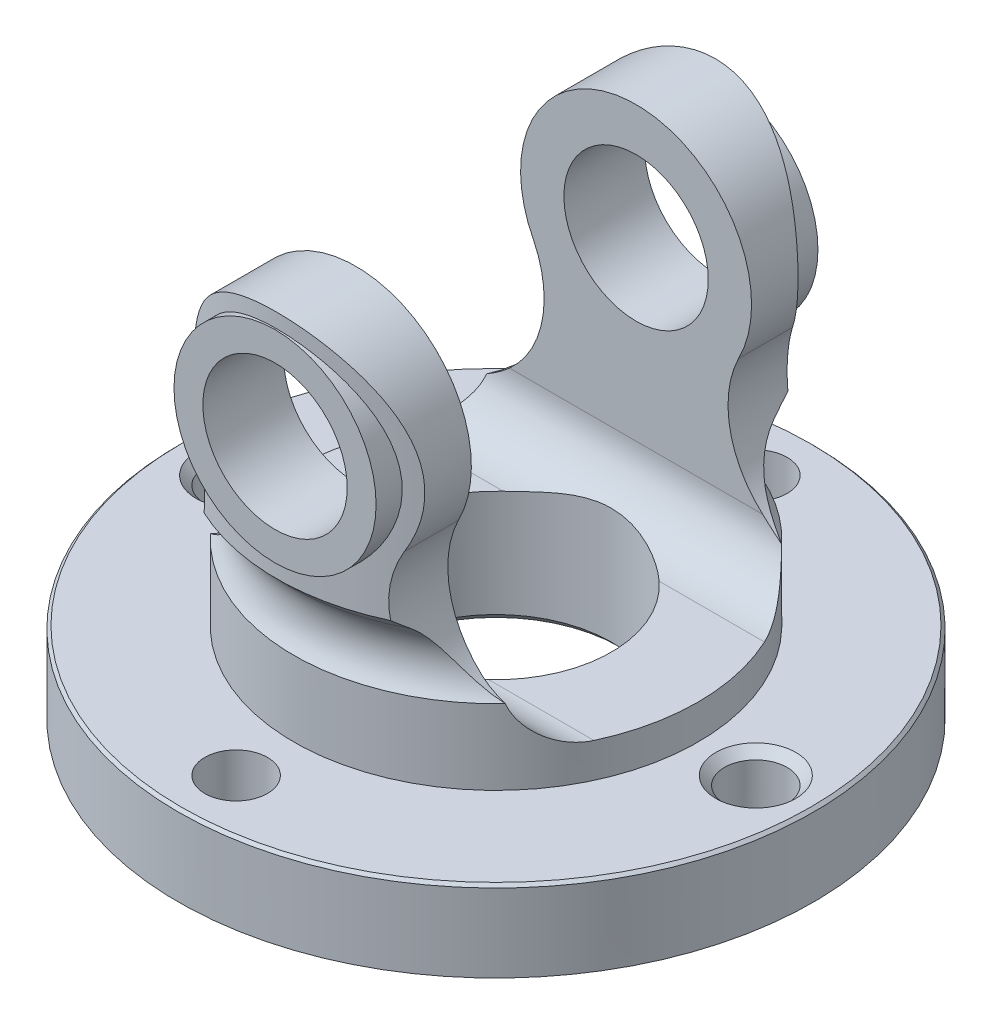
from build123d import *

# Parameters (mm, degrees)
CUT_EXTRUDE3_DEPTH      = 112.579568022
CUT_EXTRUDE3_DEPTH_BACK = 112.579568022
SKETCH2_W               = 15
SKETCH2_H               = 48
CUT_EXTRUDE4_DEPTH      = 112.579568022
CUT_EXTRUDE4_DEPTH_BACK = 112.579568022
SKETCH3_W               = 48.522720568
SKETCH3_H               = 48
FILLET1_R               = 8
DELETEFACE1_START       = 26.9999999
DELETEFACE1_DEPTH       = 53.0000001
SKETCH4_R               = 17.5
SKETCH4_R_2             = 12.5
BOSS_EXTRUDE1_DEPTH     = 14
CUT_EXTRUDE5_DEPTH      = 112.579568094
CUT_EXTRUDE5_DEPTH_BACK = 112.579568094
SKETCH5_R               = 12.5
CUT_EXTRUDE6_DEPTH      = 103.009803515
CUT_EXTRUDE6_DEPTH_BACK = 103.009803515
SKETCH8_R               = 5.425
CHAMFER1_SIZE           = 1.5
CHAMFER2_SIZE           = 0.5
CUT_EXTRUDE7_DEPTH      = 112.579568094
CUT_EXTRUDE7_DEPTH_BACK = 112.579568094
CUT_EXTRUDE8_DEPTH      = 112.579568094
CUT_EXTRUDE8_DEPTH_BACK = 112.579568094


with BuildPart() as part:
    # Sketch1 → Revolve1 (revolve)
    with BuildSketch(Plane.XY, mode=Mode.PRIVATE) as revolve1_sk:
        Polygon((20, 0), (55, 0), (55, 14), (35, 14), (35, 27), (30, 32), (38, 40), (38, 80), (30, 80), (30, 40), (20, 30), (20, 14), align=None)
    revolve(revolve1_sk.sketch.rotate(Axis((0, 0, 0), (0, 1, 0)), 90), axis=Axis((0, 0, 0), (0, 1, 0)))

    # Sketch2 → Cut-Extrude3 (cut, two sides: drawn at the far end of the back side and taken through both)
    with BuildSketch(Plane.XY.offset(-CUT_EXTRUDE3_DEPTH_BACK)):
        with Locations((-30.5, 56)):
            Rectangle(SKETCH2_W, SKETCH2_H)
        with Locations((30.5, 56)):
            Rectangle(SKETCH2_W, SKETCH2_H)
    extrude(amount=CUT_EXTRUDE3_DEPTH + CUT_EXTRUDE3_DEPTH_BACK, mode=Mode.SUBTRACT)

    # Sketch3 → Cut-Extrude4 (cut, two sides: drawn at the far end of the back side and taken through both)
    with BuildSketch(Plane(origin=(0, 0, 0), x_dir=(0, 0, -1), z_dir=(1, 0, 0)).offset(-CUT_EXTRUDE4_DEPTH_BACK)):
        with Locations((0, 56)):
            Rectangle(SKETCH3_W, SKETCH3_H)
    extrude(amount=CUT_EXTRUDE4_DEPTH + CUT_EXTRUDE4_DEPTH_BACK, mode=Mode.SUBTRACT)

    # Fillet1
    # the kernel refuses this fillet: 8 mm, written as the material it adds along each edge
    with BuildSketch(Plane(origin=(0, 32, 0), x_dir=(-0.961157197815047, 0, 0.2760015237065304), z_dir=(-0.2760015237065304, 0, -0.961157197815047))) as fillet1_piece_1_section:
        with BuildLine():
            CenterArc((41.275443262, -0.038265237), FILLET1_R, 135, 83.331971404)
            Line((35.618589013, 5.618589013), (30, 0))
            Line((30, 0), (35, -5))
        make_face()
    fillet1_piece_1 = revolve(axis=Axis((0, 32, 0), (0, 1, 0)), revolution_arc=147.956585356, mode=Mode.PRIVATE)
    fillet1_piece_1 = split(fillet1_piece_1, bisect_by=Plane(origin=(0, 32, 24.261360284), z_dir=(0, 0, 1)), keep=Keep.TOP, mode=Mode.PRIVATE)
    fillet1_piece_1 = split(fillet1_piece_1, bisect_by=Plane(origin=(0, 32, 0), z_dir=(0, -1, 0)), keep=Keep.TOP, mode=Mode.PRIVATE)
    add(fillet1_piece_1)
    with BuildSketch(Plane(origin=(0, 32, 0), x_dir=(-0.961157197815047, 0, 0.2760015237065304), z_dir=(-0.2760015237065304, 0, -0.961157197815047))) as fillet1_piece_2_section:
        with BuildLine():
            CenterArc((41.275443262, -0.038265237), FILLET1_R, 135, 83.331971404)
            Line((35.618589013, 5.618589013), (30, 0))
            Line((30, 0), (35, -5))
        make_face()
    fillet1_piece_2 = revolve(axis=Axis((0, 32, 0), (0, 1, 0)), revolution_arc=147.956585356, mode=Mode.PRIVATE)
    fillet1_piece_2 = split(fillet1_piece_2, bisect_by=Plane(origin=(-23, 32, 0), z_dir=(1, 0, 0)), keep=Keep.TOP, mode=Mode.PRIVATE)
    fillet1_piece_2 = split(fillet1_piece_2, bisect_by=Plane(origin=(0, 32, 24.261360284), z_dir=(0, 0, 1)), keep=Keep.TOP, mode=Mode.PRIVATE)
    fillet1_piece_2 = split(fillet1_piece_2, bisect_by=Plane(origin=(23, 32, 0), z_dir=(-1, 0, 0)), keep=Keep.TOP, mode=Mode.PRIVATE)
    add(fillet1_piece_2)
    with BuildSketch(Plane(origin=(0, 32, 0), x_dir=(0, 0, -1), z_dir=(1, 0, 0))) as fillet1_piece_3_section:
        with BuildLine():
            CenterArc((41.275443262, -0.038265237), FILLET1_R, 135, 83.331971404)
            Line((35.618589013, 5.618589013), (30, 0))
            Line((30, 0), (35, -5))
        make_face()
    fillet1_piece_3 = revolve(axis=Axis((0, 32, 0), (0, 1, 0)), revolution_arc=73.970965647, mode=Mode.PRIVATE)
    fillet1_piece_3 = split(fillet1_piece_3, bisect_by=Plane(origin=(0, 32, -24.261360284), z_dir=(0, 0, -1)), keep=Keep.TOP, mode=Mode.PRIVATE)
    fillet1_piece_3 = split(fillet1_piece_3, bisect_by=Plane(origin=(-23, 32, 0), z_dir=(1, 0, 0)), keep=Keep.TOP, mode=Mode.PRIVATE)
    add(fillet1_piece_3)
    with BuildSketch(Plane(origin=(0, 32, 0), x_dir=(0, 0, -1), z_dir=(1, 0, 0))) as fillet1_piece_4_section:
        with BuildLine():
            CenterArc((41.275443262, -0.038265237), FILLET1_R, 135, 83.331971404)
            Line((35.618589013, 5.618589013), (30, 0))
            Line((30, 0), (35, -5))
        make_face()
    fillet1_piece_4 = revolve(axis=Axis((0, 32, 0), (0, 1, 0)), revolution_arc=73.970965647, mode=Mode.PRIVATE)
    fillet1_piece_4 = split(fillet1_piece_4, bisect_by=Plane(origin=(0, 32, 0), z_dir=(0, -1, 0)), keep=Keep.TOP, mode=Mode.PRIVATE)
    fillet1_piece_4 = split(fillet1_piece_4, bisect_by=Plane(origin=(0, 32, -24.261360284), z_dir=(0, 0, -1)), keep=Keep.TOP, mode=Mode.PRIVATE)
    add(fillet1_piece_4)
    with BuildSketch(Plane(origin=(0, 32, 0), x_dir=(0.9611218946578147, 0, -0.2761244350096031), z_dir=(0.2761244350096031, 0, 0.9611218946578147))) as fillet1_piece_5_section:
        with BuildLine():
            CenterArc((41.275443262, -0.038265237), FILLET1_R, 135, 83.331971404)
            Line((35.618589013, 5.618589013), (30, 0))
            Line((30, 0), (35, -5))
        make_face()
    fillet1_piece_5 = revolve(axis=Axis((0, 32, 0), (0, 1, 0)), revolution_arc=73.970965647, mode=Mode.PRIVATE)
    fillet1_piece_5 = split(fillet1_piece_5, bisect_by=Plane(origin=(0, 32, 0), z_dir=(0, -1, 0)), keep=Keep.TOP, mode=Mode.PRIVATE)
    fillet1_piece_5 = split(fillet1_piece_5, bisect_by=Plane(origin=(0, 32, -24.261360284), z_dir=(0, 0, -1)), keep=Keep.TOP, mode=Mode.PRIVATE)
    add(fillet1_piece_5)
    with BuildSketch(Plane(origin=(0, 32, 0), x_dir=(0.9611218946578147, 0, -0.2761244350096031), z_dir=(0.2761244350096031, 0, 0.9611218946578147))) as fillet1_piece_6_section:
        with BuildLine():
            CenterArc((41.275443262, -0.038265237), FILLET1_R, 135, 83.331971404)
            Line((35.618589013, 5.618589013), (30, 0))
            Line((30, 0), (35, -5))
        make_face()
    fillet1_piece_6 = revolve(axis=Axis((0, 32, 0), (0, 1, 0)), revolution_arc=73.970965647, mode=Mode.PRIVATE)
    fillet1_piece_6 = split(fillet1_piece_6, bisect_by=Plane(origin=(0, 32, -24.261360284), z_dir=(0, 0, -1)), keep=Keep.TOP, mode=Mode.PRIVATE)
    fillet1_piece_6 = split(fillet1_piece_6, bisect_by=Plane(origin=(23, 32, 0), z_dir=(-1, 0, 0)), keep=Keep.TOP, mode=Mode.PRIVATE)
    add(fillet1_piece_6)

    # DeleteFace1: read off the stored shape, not the designer's step
    # DeleteFace1 outline → DeleteFace1 (add)
    with BuildSketch(Plane(origin=(0, 0, 0), x_dir=(1, 0, 0), z_dir=(0, 1, 0)).offset(DELETEFACE1_START)):
        with BuildLine():
            Line((-17.646143974, 24.261360284), (17.646143974, 24.261360284))
            ThreePointArc((17.646143974, 24.261360284), (0, 30), (-17.646143974, 24.261360284))
        make_face()
        with BuildLine():
            Line((17.646143974, -24.261360284), (-17.646143974, -24.261360284))
            ThreePointArc((-17.646143974, -24.261360284), (0, -30), (17.646143974, -24.261360284))
        make_face()
    extrude(amount=DELETEFACE1_DEPTH)

    # Sketch4 → Boss-Extrude1 (add)
    with BuildSketch(Plane.XY.offset(-24.261360284)):
        with Locations((0, 60)):
            Circle(SKETCH4_R)
        with Locations((0, 60)):
            Circle(SKETCH4_R_2, mode=Mode.SUBTRACT)
    boss_extrude1 = extrude(amount=-BOSS_EXTRUDE1_DEPTH)

    # Mirror1: Boss-Extrude1 across plane
    add(boss_extrude1.mirror(Plane.XY))

    # Sketch5 → Cut-Extrude5 (cut, two sides: drawn at the far end of the back side and taken through both)
    with BuildSketch(Plane.XY.offset(-CUT_EXTRUDE5_DEPTH_BACK)):
        with Locations((0, 60)):
            Circle(SKETCH5_R)
    extrude(amount=CUT_EXTRUDE5_DEPTH + CUT_EXTRUDE5_DEPTH_BACK, mode=Mode.SUBTRACT)

    # Sketch7 → Revolve3 (revolve)
    with BuildSketch(Plane(origin=(0, 0, 0), x_dir=(0, 0, -1), z_dir=(1, 0, 0)), mode=Mode.PRIVATE) as revolve3_sk:
        with BuildLine():
            Line((-22.395862352, 27), (-22.395862352, 32))
            Line((-22.395862352, 32), (-33.275534777, 32))
            ThreePointArc((-33.275534777, 32), (-33.712611988, 29.35336686), (-35, 27))
            Line((-35, 27), (-22.395862352, 27))
        make_face()
    revolve(revolve3_sk.sketch.rotate(Axis((0, 0, 0), (0, 1, 0)), 180), axis=Axis((0, 0, 0), (0, 1, 0)))

    # Sketch8 → Cut-Extrude6 (cut, two sides: drawn at the far end of the back side and taken through both)
    with BuildSketch(Plane(origin=(0, 14, 0), x_dir=(1, 0, 0), z_dir=(0, 1, 0)).offset(-CUT_EXTRUDE6_DEPTH_BACK)):
        with Locations(Location((0, 45, 0), (0, 0, 270))):
            Circle(SKETCH8_R)
        with Locations(Location((45, 0, 0), (0, 0, 270))):
            Circle(SKETCH8_R)
        with Locations(Location((0, -45, 0), (0, 0, 270))):
            Circle(SKETCH8_R)
        with Locations(Location((-45, 0, 0), (0, 0, 270))):
            Circle(SKETCH8_R)
    extrude(amount=CUT_EXTRUDE6_DEPTH + CUT_EXTRUDE6_DEPTH_BACK, mode=Mode.SUBTRACT)

    # Chamfer1
    chamfer1_edges = [part.edges().sort_by_distance(p)[0] for p in [
        (0, 0, 20),
        (0, 0, -50.425),
        (45, 14, -5.425),
        (45, 0, -5.425),
        (0, 0, 39.575),
        (-45, 14, -5.425),
        (-45, 0, -5.425),
    ]]
    chamfer(chamfer1_edges, length=CHAMFER1_SIZE)

    # Chamfer2
    chamfer2_edges = [part.edges().sort_by_distance(p)[0] for p in [
        (0, 14, 55),
    ]]
    chamfer(chamfer2_edges, length=CHAMFER2_SIZE)

    # Sketch9 → Cut-Extrude7 (cut, two sides: drawn at the far end of the back side and taken through both)
    with BuildSketch(Plane(origin=(0, 0, 0), x_dir=(0, 0, -1), z_dir=(1, 0, 0)).offset(-CUT_EXTRUDE7_DEPTH_BACK)):
        with BuildLine():
            Line((-24.261360284, 32), (24.261360284, 32))
            Line((24.261360284, 32), (24.261360284, 29.5))
            ThreePointArc((24.261360284, 29.5), (21.478874706, 22.782485579), (14.761360284, 20))
            Line((14.761360284, 20), (-14.761360284, 20))
            ThreePointArc((-14.761360284, 20), (-21.478874706, 22.782485579), (-24.261360284, 29.5))
            Line((-24.261360284, 29.5), (-24.261360284, 32))
        make_face()
    extrude(amount=CUT_EXTRUDE7_DEPTH + CUT_EXTRUDE7_DEPTH_BACK, mode=Mode.SUBTRACT)

    # Sketch10 → Cut-Extrude8 (cut, two sides: drawn at the far end of the back side and taken through both)
    with BuildSketch(Plane.XY.offset(-CUT_EXTRUDE8_DEPTH_BACK)):
        with BuildLine():
            Line((-25.544510939, 27), (-25.544510939, 88.521994175))
            Line((-25.544510939, 88.521994175), (25.544510939, 88.521994175))
            Line((25.544510939, 88.521994175), (25.544510939, 27))
            ThreePointArc((25.544510939, 27), (16.817478375, 37.293213059), (17.735923741, 50.756785784))
            ThreePointArc((17.735923741, 50.756785784), (0, 80), (-17.735923741, 50.756785784))
            ThreePointArc((-17.735923741, 50.756785784), (-16.817478375, 37.293213059), (-25.544510939, 27))
        make_face()
    extrude(amount=CUT_EXTRUDE8_DEPTH + CUT_EXTRUDE8_DEPTH_BACK, mode=Mode.SUBTRACT)


solid = part.part
